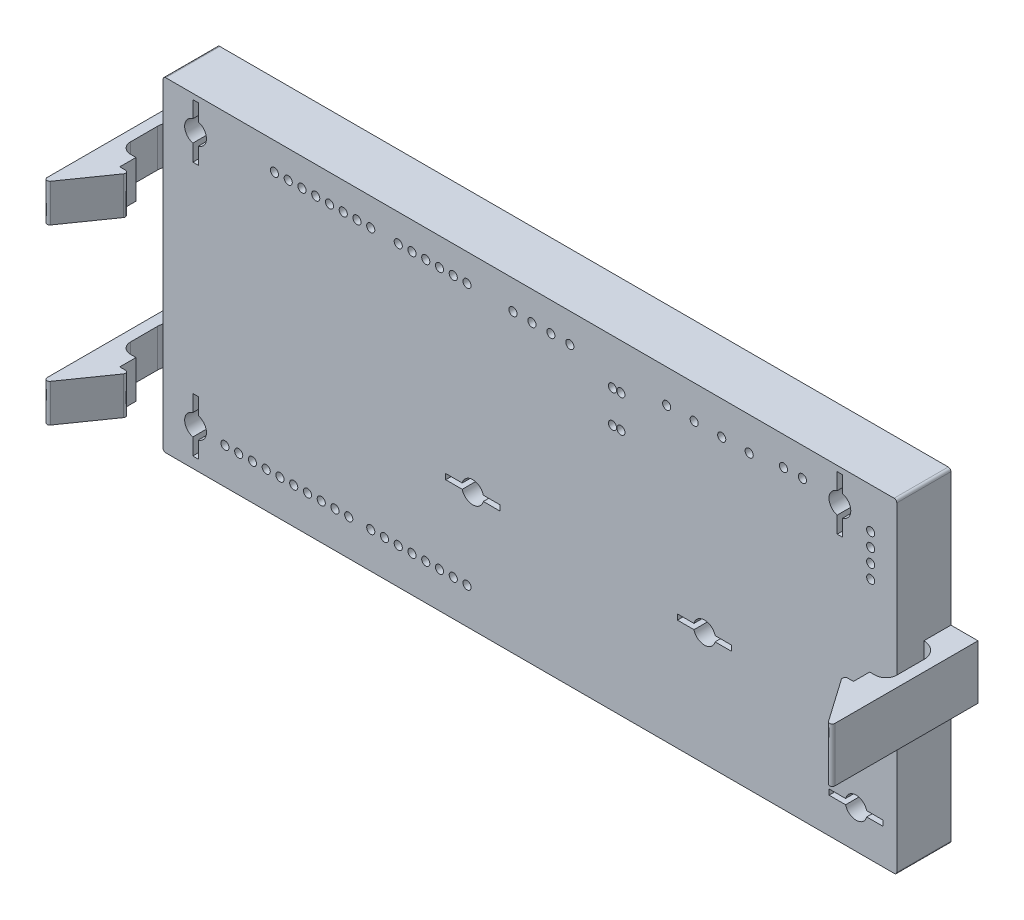
from build123d import *
from build123d.topology import SkipClean

# Parameters (mm, degrees)
SKETCH1_R           = 0.6
SKETCH1_R_2         = 0.65
SKETCH1_R_3         = 0.508
SKETCH1_R_4         = 0.1
SKETCH1_R_5         = 2
SKETCH1_R_6         = 0.5
BOSS_EXTRUDE1_DEPTH = 1.6
SKETCH4_R           = 0.75
BOSS_EXTRUDE2_DEPTH = 10
SKETCH4_5_R         = 2.0125
CUT_EXTRUDE1_DEPTH  = 5
SKETCH5_W           = 10
SKETCH5_H           = 1
SKETCH5_W_2         = 1
SKETCH5_H_2         = 10
CUT_EXTRUDE2_DEPTH  = 6
SKETCH8_R           = 1.475
CUT_EXTRUDE3_DEPTH  = 7
SKETCH9_W           = 3
SKETCH9_H           = 7
SKETCH9_W_2         = 2
SKETCH9_H_2         = 10
BOSS_EXTRUDE3_DEPTH = 5
BOSS_EXTRUDE4_START = -5
SKETCH9_3_W         = 2
SKETCH9_3_H         = 7
SKETCH9_3_H_2       = 10
BOSS_EXTRUDE4_DEPTH = 13
BOSS_EXTRUDE5_START = -25.05003
BOSS_EXTRUDE5_DEPTH = 10
BOSS_EXTRUDE6_START = -10.5
BOSS_EXTRUDE6_DEPTH = 7
BOSS_EXTRUDE7_START = -49.5
BOSS_EXTRUDE7_DEPTH = 7
FILLET1_R           = 0.5
FILLET2_R           = 0.5
BOSS_EXTRUDE8_START = -18
SKETCH9_4_W         = 3
SKETCH9_4_H         = 7
BOSS_EXTRUDE8_DEPTH = 3
BOSS_EXTRUDE9_START = -18
SKETCH9_5_W         = 3
SKETCH9_5_H         = 10
BOSS_EXTRUDE9_DEPTH = 3
FILLET3_R           = 3
FILLET4_R           = 3
FILLET5_R           = 2
FILLET6_R           = 2


with BuildPart() as part:
    # Sketch1 → Boss-Extrude1 (new body)
    with BuildSketch(Plane(origin=(0, 0, 0), x_dir=(-1, 0, 0), z_dir=(0, 0, -1))):
        with BuildLine():
            Line((-135.506999993, -0.500059222), (-135.5, -59.6))
            ThreePointArc((-135.5, -59.6), (-135.357842712, -59.893198052), (-135.05, -60))
            Line((-135.05, -60), (-0.507998976, -59.999936012))
            ThreePointArc((-0.507998976, -59.999936012), (-0.149286077, -59.856370235), (0, -59.5))
            Line((0, -59.5), (0, -0.5))
            ThreePointArc((0, -0.5), (-0.146446609, -0.146446609), (-0.5, 0))
            Line((-0.5, 0), (-135.006999996, 0))
            ThreePointArc((-135.006999996, 0), (-135.360574324, -0.146467548), (-135.506999993, -0.500059222))
        make_face()
        with Locations(Location((-118.075, -5.3, 0), (0, 0, 180))):
            Circle(SKETCH1_R, mode=Mode.SUBTRACT)
        with Locations(Location((-114.575, -5.3, 0), (0, 0, 180))):
            Circle(SKETCH1_R, mode=Mode.SUBTRACT)
        with Locations(Location((-108.25, -6.15, 0), (0, 0, 180))):
            Circle(SKETCH1_R_2, mode=Mode.SUBTRACT)
        with Locations(Location((-98.09, -6.15, 0), (0, 0, 180))):
            Circle(SKETCH1_R_2, mode=Mode.SUBTRACT)
        with Locations(Location((-103.17, -6.15, 0), (0, 0, 180))):
            Circle(SKETCH1_R_2, mode=Mode.SUBTRACT)
        with Locations(Location((-93.01, -6.15, 0), (0, 0, 180))):
            Circle(SKETCH1_R_2, mode=Mode.SUBTRACT)
        with Locations(Location((-56.134, -5.08, 0), (0, 0, 180))):
            Circle(SKETCH1_R_3, mode=Mode.SUBTRACT)
        with Locations(Location((-71.625, -5.35, 0), (0, 0, 180))):
            Circle(SKETCH1_R, mode=Mode.SUBTRACT)
        with Locations(Location((-68.125, -5.35, 0), (0, 0, 180))):
            Circle(SKETCH1_R, mode=Mode.SUBTRACT)
        with Locations(Location((-64.625, -5.35, 0), (0, 0, 180))):
            Circle(SKETCH1_R, mode=Mode.SUBTRACT)
        with Locations(Location((-75.125, -5.35, 0), (0, 0, 180))):
            Circle(SKETCH1_R, mode=Mode.SUBTRACT)
        with Locations(Location((-102.132, -20.3635, 0), (0, 0, 180))):
            Circle(SKETCH1_R_4, mode=Mode.SUBTRACT)
        with Locations(Location((-102.132, -19.3635, 0), (0, 0, 180))):
            Circle(SKETCH1_R_4, mode=Mode.SUBTRACT)
        with Locations(Location((-102.132, -18.3635, 0), (0, 0, 180))):
            Circle(SKETCH1_R_4, mode=Mode.SUBTRACT)
        with Locations(Location((-103.132, -20.3635, 0), (0, 0, 180))):
            Circle(SKETCH1_R_4, mode=Mode.SUBTRACT)
        with Locations(Location((-103.132, -19.3635, 0), (0, 0, 180))):
            Circle(SKETCH1_R_4, mode=Mode.SUBTRACT)
        with Locations(Location((-103.132, -18.3635, 0), (0, 0, 180))):
            Circle(SKETCH1_R_4, mode=Mode.SUBTRACT)
        with Locations(Location((-104.132, -20.3635, 0), (0, 0, 180))):
            Circle(SKETCH1_R_4, mode=Mode.SUBTRACT)
        with Locations(Location((-104.132, -19.3635, 0), (0, 0, 180))):
            Circle(SKETCH1_R_4, mode=Mode.SUBTRACT)
        with Locations(Location((-104.132, -18.3635, 0), (0, 0, 180))):
            Circle(SKETCH1_R_4, mode=Mode.SUBTRACT)
        with Locations(Location((-100, -39, 0), (0, 0, 180))):
            Circle(SKETCH1_R_5, mode=Mode.SUBTRACT)
        with Locations(Location((-13.97, -53.34, 0), (0, 0, 180))):
            Circle(SKETCH1_R_3, mode=Mode.SUBTRACT)
        with Locations(Location((-16.51, -53.34, 0), (0, 0, 180))):
            Circle(SKETCH1_R_3, mode=Mode.SUBTRACT)
        with Locations(Location((-19.05, -53.34, 0), (0, 0, 180))):
            Circle(SKETCH1_R_3, mode=Mode.SUBTRACT)
        with Locations(Location((-29.21, -53.34, 0), (0, 0, 180))):
            Circle(SKETCH1_R_3, mode=Mode.SUBTRACT)
        with Locations(Location((-26.67, -53.34, 0), (0, 0, 180))):
            Circle(SKETCH1_R_3, mode=Mode.SUBTRACT)
        with Locations(Location((-24.13, -53.34, 0), (0, 0, 180))):
            Circle(SKETCH1_R_3, mode=Mode.SUBTRACT)
        with Locations(Location((-21.59, -53.34, 0), (0, 0, 180))):
            Circle(SKETCH1_R_3, mode=Mode.SUBTRACT)
        with Locations(Location((-28.194, -5.08, 0), (0, 0, 180))):
            Circle(SKETCH1_R_3, mode=Mode.SUBTRACT)
        with Locations(Location((-25.654, -5.08, 0), (0, 0, 180))):
            Circle(SKETCH1_R_3, mode=Mode.SUBTRACT)
        with Locations(Location((-20.574, -5.08, 0), (0, 0, 180))):
            Circle(SKETCH1_R_3, mode=Mode.SUBTRACT)
        with Locations(Location((-23.114, -5.08, 0), (0, 0, 180))):
            Circle(SKETCH1_R_3, mode=Mode.SUBTRACT)
        with Locations(Location((-45.974, -53.34, 0), (0, 0, 180))):
            Circle(SKETCH1_R_3, mode=Mode.SUBTRACT)
        with Locations(Location((-43.434, -53.34, 0), (0, 0, 180))):
            Circle(SKETCH1_R_3, mode=Mode.SUBTRACT)
        with Locations(Location((-40.894, -53.34, 0), (0, 0, 180))):
            Circle(SKETCH1_R_3, mode=Mode.SUBTRACT)
        with Locations(Location((-34.29, -53.34, 0), (0, 0, 180))):
            Circle(SKETCH1_R_3, mode=Mode.SUBTRACT)
        with Locations(Location((-38.354, -53.34, 0), (0, 0, 180))):
            Circle(SKETCH1_R_3, mode=Mode.SUBTRACT)
        with Locations(Location((-38.354, -5.08, 0), (0, 0, 180))):
            Circle(SKETCH1_R_3, mode=Mode.SUBTRACT)
        with Locations(Location((-43.434, -5.08, 0), (0, 0, 180))):
            Circle(SKETCH1_R_3, mode=Mode.SUBTRACT)
        with Locations(Location((-45.974, -5.08, 0), (0, 0, 180))):
            Circle(SKETCH1_R_3, mode=Mode.SUBTRACT)
        with Locations(Location((-35.814, -5.08, 0), (0, 0, 180))):
            Circle(SKETCH1_R_3, mode=Mode.SUBTRACT)
        with Locations(Location((-33.274, -5.08, 0), (0, 0, 180))):
            Circle(SKETCH1_R_3, mode=Mode.SUBTRACT)
        with Locations(Location((-30.734, -5.08, 0), (0, 0, 180))):
            Circle(SKETCH1_R_3, mode=Mode.SUBTRACT)
        with Locations(Location((-31.75, -53.34, 0), (0, 0, 180))):
            Circle(SKETCH1_R_3, mode=Mode.SUBTRACT)
        with Locations(Location((-53.594, -53.34, 0), (0, 0, 180))):
            Circle(SKETCH1_R_3, mode=Mode.SUBTRACT)
        with Locations(Location((-51.054, -53.34, 0), (0, 0, 180))):
            Circle(SKETCH1_R_3, mode=Mode.SUBTRACT)
        with Locations(Location((-48.514, -53.34, 0), (0, 0, 180))):
            Circle(SKETCH1_R_3, mode=Mode.SUBTRACT)
        with Locations(Location((-53.594, -5.08, 0), (0, 0, 180))):
            Circle(SKETCH1_R_3, mode=Mode.SUBTRACT)
        with Locations(Location((-51.054, -5.08, 0), (0, 0, 180))):
            Circle(SKETCH1_R_3, mode=Mode.SUBTRACT)
        with Locations(Location((-48.514, -5.08, 0), (0, 0, 180))):
            Circle(SKETCH1_R_3, mode=Mode.SUBTRACT)
        with Locations(Location((-56.134, -53.34, 0), (0, 0, 180))):
            Circle(SKETCH1_R_3, mode=Mode.SUBTRACT)
        with Locations(Location((-57.2008, -37.9476, 0), (0, 0, 180))):
            Circle(SKETCH1_R_5, mode=Mode.SUBTRACT)
        with Locations(Location((-125, -6, 0), (0, 0, 180))):
            Circle(SKETCH1_R_5, mode=Mode.SUBTRACT)
        with Locations(Location((-128, -53, 0), (0, 0, 180))):
            Circle(SKETCH1_R_5, mode=Mode.SUBTRACT)
        with Locations(Location((-6, -53, 0), (0, 0, 180))):
            Circle(SKETCH1_R_5, mode=Mode.SUBTRACT)
        with Locations(Location((-6, -6, 0), (0, 0, 180))):
            Circle(SKETCH1_R_5, mode=Mode.SUBTRACT)
        with Locations(Location((-11.43, -53.34, 0), (0, 0, 180))):
            Circle(SKETCH1_R_3, mode=Mode.SUBTRACT)
        with Locations(Location((-130.682, -10.04, 0), (0, 0, 180))):
            Circle(SKETCH1_R_6, mode=Mode.SUBTRACT)
        with Locations(Location((-130.682, -7.5, 0), (0, 0, 180))):
            Circle(SKETCH1_R_6, mode=Mode.SUBTRACT)
        with Locations(Location((-130.682, -12.58, 0), (0, 0, 180))):
            Circle(SKETCH1_R_6, mode=Mode.SUBTRACT)
        with Locations(Location((-130.682, -15.12, 0), (0, 0, 180))):
            Circle(SKETCH1_R_6, mode=Mode.SUBTRACT)
        with BuildLine():
            Line((-82.775, -8.85), (-84.775, -8.85))
            ThreePointArc((-84.775, -8.85), (-85.275, -8.35), (-84.775, -7.85))
            Line((-84.775, -7.85), (-82.775, -7.85))
            ThreePointArc((-82.775, -7.85), (-82.275, -8.35), (-82.775, -8.85))
        make_face(mode=Mode.SUBTRACT)
        with BuildLine():
            Line((-82.775, -14.85), (-84.775, -14.85))
            ThreePointArc((-84.775, -14.85), (-85.275, -14.35), (-84.775, -13.85))
            Line((-84.775, -13.85), (-82.775, -13.85))
            ThreePointArc((-82.775, -13.85), (-82.275, -14.35), (-82.775, -14.85))
        make_face(mode=Mode.SUBTRACT)
        with BuildLine():
            Line((-78.575, -10.35), (-78.575, -12.35))
            ThreePointArc((-78.575, -12.35), (-79.075, -12.85), (-79.575, -12.35))
            Line((-79.575, -12.35), (-79.575, -10.35))
            ThreePointArc((-79.575, -10.35), (-79.075, -9.85), (-78.575, -10.35))
        make_face(mode=Mode.SUBTRACT)
    extrude(amount=-BOSS_EXTRUDE1_DEPTH)


with BuildPart() as body_2:
    # Sketch4 → Boss-Extrude2 (new body)
    with BuildSketch(Plane(origin=(0, 0, -5), x_dir=(-1, 0, 0), z_dir=(0, 0, -1))):
        with BuildLine():
            Line((-135.506999993, -0.500059222), (-135.5, -59.6))
            ThreePointArc((-135.5, -59.6), (-135.357842712, -59.893198052), (-135.05, -60))
            Line((-135.05, -60), (-0.507998976, -59.999936012))
            ThreePointArc((-0.507998976, -59.999936012), (-0.149286077, -59.856370235), (0, -59.5))
            Line((0, -59.5), (0, -0.5))
            ThreePointArc((0, -0.5), (-0.146446609, -0.146446609), (-0.5, 0))
            Line((-0.5, 0), (-135.006999996, 0))
            ThreePointArc((-135.006999996, 0), (-135.360574324, -0.146467548), (-135.506999993, -0.500059222))
        make_face()
        with Locations((-11.43, -53.34)):
            Circle(SKETCH4_R, mode=Mode.SUBTRACT)
        with Locations((-13.97, -53.34)):
            Circle(SKETCH4_R, mode=Mode.SUBTRACT)
        with Locations((-16.51, -53.34)):
            Circle(SKETCH4_R, mode=Mode.SUBTRACT)
        with Locations((-19.05, -53.34)):
            Circle(SKETCH4_R, mode=Mode.SUBTRACT)
        with Locations((-21.59, -53.34)):
            Circle(SKETCH4_R, mode=Mode.SUBTRACT)
        with Locations((-24.13, -53.34)):
            Circle(SKETCH4_R, mode=Mode.SUBTRACT)
        with Locations((-26.67, -53.34)):
            Circle(SKETCH4_R, mode=Mode.SUBTRACT)
        with Locations((-29.21, -53.34)):
            Circle(SKETCH4_R, mode=Mode.SUBTRACT)
        with Locations((-31.75, -53.34)):
            Circle(SKETCH4_R, mode=Mode.SUBTRACT)
        with Locations((-34.29, -53.34)):
            Circle(SKETCH4_R, mode=Mode.SUBTRACT)
        with Locations((-38.354, -53.34)):
            Circle(SKETCH4_R, mode=Mode.SUBTRACT)
        with Locations((-40.894, -53.34)):
            Circle(SKETCH4_R, mode=Mode.SUBTRACT)
        with Locations((-43.434, -53.34)):
            Circle(SKETCH4_R, mode=Mode.SUBTRACT)
        with Locations((-45.974, -53.34)):
            Circle(SKETCH4_R, mode=Mode.SUBTRACT)
        with Locations((-48.514, -53.34)):
            Circle(SKETCH4_R, mode=Mode.SUBTRACT)
        with Locations((-51.054, -53.34)):
            Circle(SKETCH4_R, mode=Mode.SUBTRACT)
        with Locations((-53.594, -53.34)):
            Circle(SKETCH4_R, mode=Mode.SUBTRACT)
        with Locations((-56.134, -53.34)):
            Circle(SKETCH4_R, mode=Mode.SUBTRACT)
        with Locations((-20.574, -5.08)):
            Circle(SKETCH4_R, mode=Mode.SUBTRACT)
        with Locations((-23.114, -5.08)):
            Circle(SKETCH4_R, mode=Mode.SUBTRACT)
        with Locations((-25.654, -5.08)):
            Circle(SKETCH4_R, mode=Mode.SUBTRACT)
        with Locations((-28.194, -5.08)):
            Circle(SKETCH4_R, mode=Mode.SUBTRACT)
        with Locations((-30.734, -5.08)):
            Circle(SKETCH4_R, mode=Mode.SUBTRACT)
        with Locations((-33.274, -5.08)):
            Circle(SKETCH4_R, mode=Mode.SUBTRACT)
        with Locations((-35.814, -5.08)):
            Circle(SKETCH4_R, mode=Mode.SUBTRACT)
        with Locations((-38.354, -5.08)):
            Circle(SKETCH4_R, mode=Mode.SUBTRACT)
        with Locations((-43.434, -5.08)):
            Circle(SKETCH4_R, mode=Mode.SUBTRACT)
        with Locations((-45.974, -5.08)):
            Circle(SKETCH4_R, mode=Mode.SUBTRACT)
        with Locations((-48.514, -5.08)):
            Circle(SKETCH4_R, mode=Mode.SUBTRACT)
        with Locations((-51.054, -5.08)):
            Circle(SKETCH4_R, mode=Mode.SUBTRACT)
        with Locations((-53.594, -5.08)):
            Circle(SKETCH4_R, mode=Mode.SUBTRACT)
        with Locations((-56.134, -5.08)):
            Circle(SKETCH4_R, mode=Mode.SUBTRACT)
        with Locations((-64.625, -5.35)):
            Circle(SKETCH4_R, mode=Mode.SUBTRACT)
        with Locations((-68.125, -5.35)):
            Circle(SKETCH4_R, mode=Mode.SUBTRACT)
        with Locations((-71.625, -5.35)):
            Circle(SKETCH4_R, mode=Mode.SUBTRACT)
        with Locations((-75.125, -5.35)):
            Circle(SKETCH4_R, mode=Mode.SUBTRACT)
        with Locations((-83, -8.35)):
            Circle(SKETCH4_R, mode=Mode.SUBTRACT)
        with Locations((-84.55, -8.35)):
            Circle(SKETCH4_R, mode=Mode.SUBTRACT)
        with Locations((-83, -14.35)):
            Circle(SKETCH4_R, mode=Mode.SUBTRACT)
        with Locations((-84.55, -14.35)):
            Circle(SKETCH4_R, mode=Mode.SUBTRACT)
        with Locations((-93.01, -6.15)):
            Circle(SKETCH4_R, mode=Mode.SUBTRACT)
        with Locations((-98.09, -6.15)):
            Circle(SKETCH4_R, mode=Mode.SUBTRACT)
        with Locations((-103.17, -6.15)):
            Circle(SKETCH4_R, mode=Mode.SUBTRACT)
        with Locations((-108.25, -6.15)):
            Circle(SKETCH4_R, mode=Mode.SUBTRACT)
        with Locations((-114.575, -5.3)):
            Circle(SKETCH4_R, mode=Mode.SUBTRACT)
        with Locations((-118.075, -5.3)):
            Circle(SKETCH4_R, mode=Mode.SUBTRACT)
        with Locations((-130.682, -15.12)):
            Circle(SKETCH4_R, mode=Mode.SUBTRACT)
        with Locations((-130.682, -12.58)):
            Circle(SKETCH4_R, mode=Mode.SUBTRACT)
        with Locations((-130.682, -10.04)):
            Circle(SKETCH4_R, mode=Mode.SUBTRACT)
        with Locations((-130.682, -7.5)):
            Circle(SKETCH4_R, mode=Mode.SUBTRACT)
    extrude(amount=BOSS_EXTRUDE2_DEPTH)

    # Sketch4<5> → Cut-Extrude1 (cut)
    with BuildSketch(Plane(origin=(0, 0, -5), x_dir=(-1, 0, 0), z_dir=(0, 0, -1))):
        with Locations((-125, -6)):
            Circle(SKETCH4_5_R)
        with Locations((-100, -39)):
            Circle(SKETCH4_5_R)
        with Locations((-128, -53)):
            Circle(SKETCH4_5_R)
        with Locations((-57.2008, -37.9476)):
            Circle(SKETCH4_5_R)
        with Locations((-6, -53)):
            Circle(SKETCH4_5_R)
        with Locations((-6, -6)):
            Circle(SKETCH4_5_R)
    extrude(amount=CUT_EXTRUDE1_DEPTH, mode=Mode.SUBTRACT)

    # Sketch5 → Cut-Extrude2 (cut)
    with BuildSketch(Plane.XY.offset(-5)):
        with Locations((128, -53)):
            Rectangle(SKETCH5_W, SKETCH5_H)
        with Locations((125, -6)):
            Rectangle(SKETCH5_W_2, SKETCH5_H_2)
        with Locations((100, -39)):
            Rectangle(SKETCH5_W, SKETCH5_H)
        with Locations((57.2008, -37.9476)):
            Rectangle(SKETCH5_W, SKETCH5_H)
        with Locations((6, -53)):
            Rectangle(SKETCH5_W_2, SKETCH5_H_2)
        with Locations((6, -6)):
            Rectangle(SKETCH5_W_2, SKETCH5_H_2)
    extrude(amount=-CUT_EXTRUDE2_DEPTH, mode=Mode.SUBTRACT)

    # Sketch8 → Cut-Extrude3 (cut)
    with BuildSketch(Plane(origin=(0, 0, -15), x_dir=(-1, 0, 0), z_dir=(0, 0, -1))):
        with Locations((-6, -6)):
            Circle(SKETCH8_R)
        with Locations((-6, -53)):
            Circle(SKETCH8_R)
        with Locations((-57.2008, -37.9476)):
            Circle(SKETCH8_R)
        with Locations((-100, -39)):
            Circle(SKETCH8_R)
        with Locations((-128, -53)):
            Circle(SKETCH8_R)
        with Locations((-125, -6)):
            Circle(SKETCH8_R)
    extrude(amount=-CUT_EXTRUDE3_DEPTH, mode=Mode.SUBTRACT)

    # Sketch9 → Boss-Extrude3 (add)
    with BuildSketch(Plane(origin=(0, 0, -15), x_dir=(-1, 0, 0), z_dir=(0, 0, -1))):
        with Locations((1.5, -46)):
            Rectangle(SKETCH9_W, SKETCH9_H)
        with Locations((4, -46)):
            Rectangle(SKETCH9_W_2, SKETCH9_H)
        with Locations((1.5, -14)):
            Rectangle(SKETCH9_W, SKETCH9_H)
        with Locations((4, -14)):
            Rectangle(SKETCH9_W_2, SKETCH9_H)
        with Locations((-139.504092213, -30.050029611)):
            Rectangle(SKETCH9_W_2, SKETCH9_H_2)
        with Locations((-137.004092213, -30.050029611)):
            Rectangle(SKETCH9_W, SKETCH9_H_2)
    extrude(amount=-BOSS_EXTRUDE3_DEPTH)


with BuildPart() as boss_extrude3_piece_1:
    # of the separate pieces the step leaves, piece 1, a body of its own (boss_extrude3_pieces)
    add(body_2.part.solids().sort_by_distance((135.006999996, 0, -5))[0])



with BuildPart() as boss_extrude3_piece_2:
    # of the separate pieces the step leaves, piece 2, a body of its own (boss_extrude3_pieces)
    add(body_2.part.solids().sort_by_distance((140.504092213, -25.050029611, -15))[0])


with BuildPart() as boss_extrude3_piece_1_1:
    add(boss_extrude3_piece_1.part)

    add(boss_extrude3_piece_2.part)  # Boss-Extrude4 merges Boss-Extrude3 piece 2
    # Sketch9<3> → Boss-Extrude4 (add)
    with BuildSketch(Plane(origin=(0, 0, -15), x_dir=(-1, 0, 0), z_dir=(0, 0, -1)).offset(BOSS_EXTRUDE4_START)):
        with Locations((4, -14)):
            Rectangle(SKETCH9_3_W, SKETCH9_3_H)
        with Locations((4, -46)):
            Rectangle(SKETCH9_3_W, SKETCH9_3_H)
        with Locations((-139.504092213, -30.050029611)):
            Rectangle(SKETCH9_3_W, SKETCH9_3_H_2)
    extrude(amount=-BOSS_EXTRUDE4_DEPTH)

    # Sketch10 → Boss-Extrude5 (add)
    with SkipClean():  # the faces are left unmerged after this step: merging them gives an invalid solid
        with BuildSketch(Plane(origin=(0, 0, 0), x_dir=(1, 0, 0), z_dir=(0, 1, 0)).offset(BOSS_EXTRUDE5_START)):
            Polygon((133.506999993, -3), (140.504092213, -13), (140.504092213, -3), align=None)
        extrude(amount=-BOSS_EXTRUDE5_DEPTH)

    # Sketch10<3> → Boss-Extrude6 (add)
    with SkipClean():  # the faces are left unmerged after this step: merging them gives an invalid solid
        with BuildSketch(Plane(origin=(0, 0, 0), x_dir=(1, 0, 0), z_dir=(0, 1, 0)).offset(BOSS_EXTRUDE6_START)):
            Polygon((-5, -13), (-5, -3), (2, -3), align=None)
        extrude(amount=-BOSS_EXTRUDE6_DEPTH)

    # Sketch10<4> → Boss-Extrude7 (add)
    with SkipClean():  # the faces are left unmerged after this step: merging them gives an invalid solid
        with BuildSketch(Plane(origin=(0, 0, 0), x_dir=(1, 0, 0), z_dir=(0, 1, 0)).offset(BOSS_EXTRUDE7_START)):
            Polygon((-5, -13), (-5, -3), (2, -3), align=None)
        extrude(amount=BOSS_EXTRUDE7_DEPTH)

    # Fillet1
    fillet1_edges = [boss_extrude3_piece_1_1.edges().sort_by_distance(p)[0] for p in [
        (140.504092213, -30.05003, 13),
        (133.506999993, -30.05003, 3),
    ]]
    fillet(fillet1_edges, radius=FILLET1_R)

    # Fillet2
    fillet2_edges = [boss_extrude3_piece_1_1.edges().sort_by_distance(p)[0] for p in [
        (2, -14, 3),
        (-5, -14, 13),
        (2, -46, 3),
        (-5, -46, 13),
    ]]
    fillet(fillet2_edges, radius=FILLET2_R)

    # Sketch9<4> → Boss-Extrude8 (add)
    with SkipClean():  # the faces are left unmerged after this step: merging them gives an invalid solid
        with BuildSketch(Plane(origin=(0, 0, -15), x_dir=(-1, 0, 0), z_dir=(0, 0, -1)).offset(BOSS_EXTRUDE8_START)):
            with Locations((1.5, -14)):
                Rectangle(SKETCH9_4_W, SKETCH9_4_H)
            with Locations((1.5, -46)):
                Rectangle(SKETCH9_4_W, SKETCH9_4_H)
        extrude(amount=BOSS_EXTRUDE8_DEPTH)

    # Sketch9<5> → Boss-Extrude9 (add)
    with SkipClean():  # the faces are left unmerged after this step: merging them gives an invalid solid
        with BuildSketch(Plane(origin=(0, 0, -15), x_dir=(-1, 0, 0), z_dir=(0, 0, -1)).offset(BOSS_EXTRUDE9_START)):
            with Locations((-137.004092213, -30.050029611)):
                Rectangle(SKETCH9_5_W, SKETCH9_5_H)
        extrude(amount=BOSS_EXTRUDE9_DEPTH)

    # Fillet3
    fillet3_edges = [boss_extrude3_piece_1_1.edges().sort_by_distance(p)[0] for p in [
        (-3, -14, -10),
        (-3, -46, -10),
    ]]
    fillet(fillet3_edges, radius=FILLET3_R - 0.0001)  # a hair under: the kernel refuses the full size

    # Fillet4
    fillet4_edges = [boss_extrude3_piece_1_1.edges().sort_by_distance(p)[0] for p in [
        (138.504092213, -30.050029611, -10),
    ]]
    fillet(fillet4_edges, radius=FILLET4_R - 0.0001)  # a hair under: the kernel refuses the full size

    # Fillet5
    fillet5_edges = [boss_extrude3_piece_1_1.edges().sort_by_distance(p)[0] for p in [
        (138.504092213, -30.050029611, 0),
    ]]
    fillet(fillet5_edges, radius=FILLET5_R)

    # Fillet6
    fillet6_edges = [boss_extrude3_piece_1_1.edges().sort_by_distance(p)[0] for p in [
        (-3, -14, 0),
        (-3, -46, 0),
    ]]
    fillet(fillet6_edges, radius=FILLET6_R)


solid = boss_extrude3_piece_1_1.part
